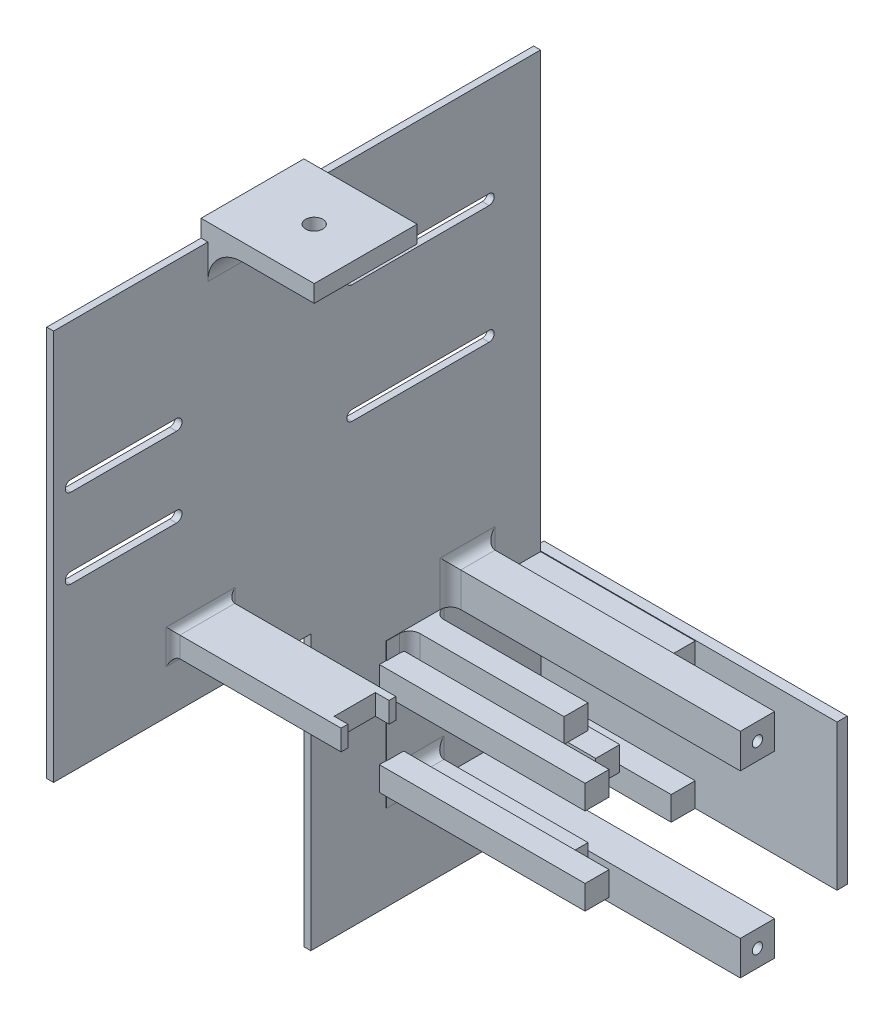
from build123d import *

# Parameters (mm, degrees)
KASSE_W                                = 148
KASSE_H                                = 148
KASSE_MAINBODY_DEPTH                   = 200
SHELL2_START                           = -145
SHELL2_OUTLINE_W                       = 145
SHELL2_OUTLINE_H                       = 194
SHELL2_DEPTH                           = 142
HULLER_TIL_MONTERING_AF_TANDHJUL_DEPTH = 20
SKETCH6_W                              = 45
SKETCH6_H                              = 42.3
MOTORBED_DEPTH                         = 0.1
SKETCH7_W                              = 10
SKETCH7_H                              = 10
MOTORHOLDER_DEPTH                      = 84.5
SKETCH18_W                             = 7
SKETCH18_H                             = 7
BOSS_EXTRUDE6_DEPTH                    = 45
SKETCH9_W                              = 7
SKETCH9_H                              = 7
MOTORHOLDER_2_DEPTH                    = 60
SKETCH8_R                              = 1.5
SKRUER_MOTORHOLDER_DEPTH               = 10
H_BRO_HOLDER_DEPTH                     = 10
SKETCH14_R                             = 10
HUL_DEPTH                              = 10
SKETCH15_W                             = 16
SKETCH15_H                             = 6
BOSS_EXTRUDE4_DEPTH                    = 45
SKETCH17_W                             = 2
SKETCH17_H                             = 6
BOSS_EXTRUDE5_DEPTH                    = 4
FILLET2_R                              = 2
FILLET3_R                              = 3
FILLET4_R                              = 3
SKETCH20_W                             = 148
SKETCH20_H                             = 200
SKETCH20_W_2                           = 142
SKETCH20_H_2                           = 194
FJERNV_G_DEPTH                         = 148
SKETCH24_W                             = 89.449587466
SKETCH24_H                             = 42.5
BOSS_EXTRUDE7_DEPTH                    = 3
SKETCH27_W                             = 34
SKETCH27_H                             = 30
BOSS_EXTRUDE8_DEPTH                    = 5
FILLET5_R                              = 10
SKETCH28_R                             = 2.5
CUT_EXTRUDE1_DEPTH                     = 10
SKETCH29_W                             = 75
SKETCH29_H                             = 80
CUT_EXTRUDE2_DEPTH                     = 10
SKETCH30_W                             = 145
SKETCH30_H                             = 220
CUT_EXTRUDE3_DEPTH                     = 1
SKETCH31_W                             = 53.079596257
SKETCH31_H                             = 27.802057415
CUT_EXTRUDE5_DEPTH                     = 1
SKETCH32_W                             = 15
SKETCH32_H                             = 20
CUT_EXTRUDE6_DEPTH                     = 2


# Read off the part's stored shape, not the designer's step: Shell2
with BuildPart() as part:
    # Kasse → Kasse mainBody (new body)
    with BuildSketch(Plane(origin=(0, 0, 0), x_dir=(1, 0, 0), z_dir=(0, 1, 0))):
        with Locations((-74, 74)):
            Rectangle(KASSE_W, KASSE_H)
    extrude(amount=KASSE_MAINBODY_DEPTH)

    # Shell2 outline → Shell2 (cut)
    with BuildSketch(Plane.XY.offset(SHELL2_START)):
        with Locations((-72.5, 100)):
            Rectangle(SHELL2_OUTLINE_W, SHELL2_OUTLINE_H)
    extrude(amount=SHELL2_DEPTH, mode=Mode.SUBTRACT)

    # Sketch4 → Huller til montering af tandhjul (cut)
    with BuildSketch(Plane(origin=(-145, 0, 0), x_dir=(0, 0, -1), z_dir=(1, 0, 0))):
        with BuildLine():
            Line((8, 133.8), (38.853233891, 133.8))
            ThreePointArc((38.853233891, 133.8), (40.453233891, 132.2), (38.853233891, 130.6))
            Line((38.853233891, 130.6), (8, 130.6))
            ThreePointArc((8, 130.6), (6.4, 132.2), (8, 133.8))
        make_face()
        with BuildLine():
            Line((8, 157), (38.853233891, 157))
            ThreePointArc((38.853233891, 157), (40.453233891, 155.4), (38.853233891, 153.8))
            Line((38.853233891, 153.8), (8, 153.8))
            ThreePointArc((8, 153.8), (6.4, 155.4), (8, 157))
        make_face()
    extrude(amount=-HULLER_TIL_MONTERING_AF_TANDHJUL_DEPTH, mode=Mode.SUBTRACT)

    # Sketch6 → Motorbed (add)
    with BuildSketch(Plane(origin=(-145, 0, 0), x_dir=(0, 0, -1), z_dir=(1, 0, 0))):
        with Locations((122.5, 49.15)):
            Rectangle(SKETCH6_W, SKETCH6_H)
    extrude(amount=MOTORBED_DEPTH)

    # Sketch7 → Motorholder (add)
    with BuildSketch(Plane(origin=(-145, 0, 0), x_dir=(0, 0, -1), z_dir=(1, 0, 0))):
        with Locations((123.75, 75.3)):
            Rectangle(SKETCH7_W, SKETCH7_H)
        with Locations((123.75, 23)):
            Rectangle(SKETCH7_W, SKETCH7_H)
    extrude(amount=MOTORHOLDER_DEPTH)

    # Sketch18 → Boss-Extrude6 (add)
    with BuildSketch(Plane(origin=(-144.9, 0, 0), x_dir=(0, 0, -1), z_dir=(1, 0, 0))):
        with Locations((110.25, 31.5)):
            Rectangle(SKETCH18_W, SKETCH18_H)
        with Locations((141.5, 31.5)):
            Rectangle(SKETCH18_W, SKETCH18_H)
        with Locations((141.5, 66.8)):
            Rectangle(SKETCH18_W, SKETCH18_H)
        with Locations((110.25, 66.8)):
            Rectangle(SKETCH18_W, SKETCH18_H)
        with Locations((121.5, 49.632946646)):
            Rectangle(SKETCH18_W, SKETCH18_H)
    extrude(amount=BOSS_EXTRUDE6_DEPTH)

    # Sketch9 → motorholder  2 (add)
    with BuildSketch(Plane(origin=(-145, 0, 0), x_dir=(0, 0, -1), z_dir=(1, 0, 0))):
        with Locations((101.5, 61.8)):
            Rectangle(SKETCH9_W, SKETCH9_H)
        with Locations((101.5, 36.5)):
            Rectangle(SKETCH9_W, SKETCH9_H)
    extrude(amount=MOTORHOLDER_2_DEPTH)

    # Sketch8 → Skruer motorholder (cut)
    with BuildSketch(Plane(origin=(-60.5, 0, 0), x_dir=(0, 0, -1), z_dir=(1, 0, 0))):
        with Locations((123.75, 75.3)):
            Circle(SKETCH8_R)
        with Locations((123.75, 23)):
            Circle(SKETCH8_R)
    extrude(amount=-SKRUER_MOTORHOLDER_DEPTH, mode=Mode.SUBTRACT)

    # Sketch11 → H-bro holder (cut)
    with BuildSketch(Plane(origin=(-145, 0, 0), x_dir=(0, 0, -1), z_dir=(1, 0, 0))):
        with BuildLine():
            Line((130, 165.21), (90, 165.21))
            ThreePointArc((90, 165.21), (88.5, 166.71), (90, 168.21))
            Line((90, 168.21), (130, 168.21))
            ThreePointArc((130, 168.21), (131.5, 166.71), (130, 165.21))
        make_face()
        with BuildLine():
            Line((130, 130.7), (90, 130.7))
            ThreePointArc((90, 130.7), (88.5, 132.2), (90, 133.7))
            Line((90, 133.7), (130, 133.7))
            ThreePointArc((130, 133.7), (131.5, 132.2), (130, 130.7))
        make_face()
    extrude(amount=-H_BRO_HOLDER_DEPTH, mode=Mode.SUBTRACT)

    # Sketch14 → Hul (cut)
    with BuildSketch(Plane(origin=(0, 200, 0), x_dir=(1, 0, 0), z_dir=(0, 1, 0))):
        with Locations(Location((-82.5, 66.16, 0), (0, 0, 270))):
            Circle(SKETCH14_R)
    extrude(amount=-HUL_DEPTH, mode=Mode.SUBTRACT)

    # Sketch15 → Boss-Extrude4 (add)
    with BuildSketch(Plane(origin=(-145, 0, 0), x_dir=(0, 0, -1), z_dir=(1, 0, 0))):
        with Locations((45.83, 100.81)):
            Rectangle(SKETCH15_W, SKETCH15_H)
    extrude(amount=BOSS_EXTRUDE4_DEPTH)

    # Sketch17 → Boss-Extrude5 (add)
    with BuildSketch(Plane(origin=(-100, 0, 0), x_dir=(0, 0, -1), z_dir=(1, 0, 0))):
        with Locations((52.83, 100.81)):
            Rectangle(SKETCH17_W, SKETCH17_H)
        with Locations((38.83, 100.81)):
            Rectangle(SKETCH17_W, SKETCH17_H)
    extrude(amount=BOSS_EXTRUDE5_DEPTH)

    # Fillet2
    fillet2_edges = [part.edges().sort_by_distance(p)[0] for p in [
        (-145, 100.81, -53.83),
        (-145, 103.81, -45.83),
        (-145, 100.81, -37.83),
        (-145, 97.81, -45.83),
    ]]
    fillet(fillet2_edges, radius=FILLET2_R)

    # Fillet3
    # the kernel refuses this fillet: 3 mm, written as the material it adds along each edge
    with BuildSketch(Plane(origin=(-145, 28, -118.75), x_dir=(0, 0, 1), z_dir=(0, -1, 0)), Plane(origin=(-145, 18, -118.75), x_dir=(0, -1, 0), z_dir=(0, 0, -1)), Plane(origin=(-145, 18, -128.75), x_dir=(0, 0, -1), z_dir=(0, 1, 0))) as fillet3_piece_1:
        with BuildLine():
            CenterArc((FILLET3_R, -FILLET3_R), FILLET3_R, 90, 90)
            Line((0, -FILLET3_R), (0, 0))
            Line((0, 0), (FILLET3_R, 0))
        make_face()
    extrude(amount=10)
    with BuildSketch(Plane(origin=(-145, 80.3, -128.75), x_dir=(0, 0, -1), z_dir=(0, -1, 0)), Plane(origin=(-145, 80.3, -118.75), x_dir=(0, 1, 0), z_dir=(0, 0, -1)), Plane(origin=(-145, 70.3, -118.75), x_dir=(0, 0, 1), z_dir=(0, 1, 0))) as fillet3_piece_2:
        with BuildLine():
            CenterArc((FILLET3_R, FILLET3_R), FILLET3_R, 180, 90)
            Line((0, FILLET3_R), (0, 0))
            Line((0, 0), (FILLET3_R, 0))
        make_face()
    extrude(amount=10)
    with BuildSketch(Plane(origin=(-145, 18, -111.25), x_dir=(0, -1, 0), z_dir=(0, 0, -1))) as fillet3_piece_3a_section:
        with BuildLine():
            CenterArc((FILLET3_R, -FILLET3_R), FILLET3_R, 90, 90)
            Line((0, -FILLET3_R), (0, 0))
            Line((0, 0), (FILLET3_R, 0))
        make_face()
    fillet3_piece_3a = extrude(amount=17.5, mode=Mode.PRIVATE)
    fillet3_piece_3a = split(fillet3_piece_3a, bisect_by=Plane(origin=(-144.320814657, 17.320814657, -118.75), z_dir=(0, 0, 1)), keep=Keep.TOP, mode=Mode.PRIVATE)
    with BuildSketch(Plane(origin=(-145, 28, -118.75), x_dir=(0, 0, 1), z_dir=(0, -1, 0))) as fillet3_piece_3b_section:
        with BuildLine():
            CenterArc((FILLET3_R, -FILLET3_R), FILLET3_R, 90, 90)
            Line((0, -FILLET3_R), (0, 0))
            Line((0, 0), (FILLET3_R, 0))
        make_face()
    fillet3_piece_3b = extrude(amount=17.5, mode=Mode.PRIVATE)
    fillet3_piece_3b = split(fillet3_piece_3b, bisect_by=Plane(origin=(-144.320814657, 18, -118.070814657), z_dir=(0, -1, 0)), keep=Keep.TOP, mode=Mode.PRIVATE)
    fillet3_piece_3 = fillet3_piece_3a & fillet3_piece_3b
    add(fillet3_piece_3)
    with BuildSketch(Plane(origin=(-145, 10.5, -128.75), x_dir=(0, 0, -1), z_dir=(0, 1, 0))) as fillet3_piece_4a_section:
        with BuildLine():
            CenterArc((FILLET3_R, -FILLET3_R), FILLET3_R, 90, 90)
            Line((0, -FILLET3_R), (0, 0))
            Line((0, 0), (FILLET3_R, 0))
        make_face()
    fillet3_piece_4a = extrude(amount=17.5, mode=Mode.PRIVATE)
    fillet3_piece_4a = split(fillet3_piece_4a, bisect_by=Plane(origin=(-144.320814657, 18, -129.429185343), z_dir=(0, -1, 0)), keep=Keep.TOP, mode=Mode.PRIVATE)
    with BuildSketch(Plane(origin=(-145, 18, -118.75), x_dir=(0, -1, 0), z_dir=(0, 0, -1))) as fillet3_piece_4b_section:
        with BuildLine():
            CenterArc((FILLET3_R, -FILLET3_R), FILLET3_R, 90, 90)
            Line((0, -FILLET3_R), (0, 0))
            Line((0, 0), (FILLET3_R, 0))
        make_face()
    fillet3_piece_4b = extrude(amount=17.5, mode=Mode.PRIVATE)
    fillet3_piece_4b = split(fillet3_piece_4b, bisect_by=Plane(origin=(-144.320814657, 17.320814657, -128.75), z_dir=(0, 0, -1)), keep=Keep.TOP, mode=Mode.PRIVATE)
    fillet3_piece_4 = fillet3_piece_4a & fillet3_piece_4b
    add(fillet3_piece_4)
    with BuildSketch(Plane(origin=(-145, 87.8, -128.75), x_dir=(0, 0, -1), z_dir=(0, -1, 0))) as fillet3_piece_5a_section:
        with BuildLine():
            CenterArc((FILLET3_R, FILLET3_R), FILLET3_R, 180, 90)
            Line((0, FILLET3_R), (0, 0))
            Line((0, 0), (FILLET3_R, 0))
        make_face()
    fillet3_piece_5a = extrude(amount=17.5, mode=Mode.PRIVATE)
    fillet3_piece_5a = split(fillet3_piece_5a, bisect_by=Plane(origin=(-144.320814657, 80.3, -129.429185343), z_dir=(0, 1, 0)), keep=Keep.TOP, mode=Mode.PRIVATE)
    with BuildSketch(Plane(origin=(-145, 80.3, -118.75), x_dir=(0, 1, 0), z_dir=(0, 0, -1))) as fillet3_piece_5b_section:
        with BuildLine():
            CenterArc((FILLET3_R, FILLET3_R), FILLET3_R, 180, 90)
            Line((0, FILLET3_R), (0, 0))
            Line((0, 0), (FILLET3_R, 0))
        make_face()
    fillet3_piece_5b = extrude(amount=17.5, mode=Mode.PRIVATE)
    fillet3_piece_5b = split(fillet3_piece_5b, bisect_by=Plane(origin=(-144.320814657, 80.979185343, -128.75), z_dir=(0, 0, -1)), keep=Keep.TOP, mode=Mode.PRIVATE)
    fillet3_piece_5 = fillet3_piece_5a & fillet3_piece_5b
    add(fillet3_piece_5)
    with BuildSketch(Plane(origin=(-145, 80.3, -111.25), x_dir=(0, 1, 0), z_dir=(0, 0, -1))) as fillet3_piece_6a_section:
        with BuildLine():
            CenterArc((FILLET3_R, FILLET3_R), FILLET3_R, 180, 90)
            Line((0, FILLET3_R), (0, 0))
            Line((0, 0), (FILLET3_R, 0))
        make_face()
    fillet3_piece_6a = extrude(amount=17.5, mode=Mode.PRIVATE)
    fillet3_piece_6a = split(fillet3_piece_6a, bisect_by=Plane(origin=(-144.320814657, 80.979185343, -118.75), z_dir=(0, 0, 1)), keep=Keep.TOP, mode=Mode.PRIVATE)
    with BuildSketch(Plane(origin=(-145, 70.3, -118.75), x_dir=(0, 0, 1), z_dir=(0, 1, 0))) as fillet3_piece_6b_section:
        with BuildLine():
            CenterArc((FILLET3_R, FILLET3_R), FILLET3_R, 180, 90)
            Line((0, FILLET3_R), (0, 0))
            Line((0, 0), (FILLET3_R, 0))
        make_face()
    fillet3_piece_6b = extrude(amount=17.5, mode=Mode.PRIVATE)
    fillet3_piece_6b = split(fillet3_piece_6b, bisect_by=Plane(origin=(-144.320814657, 80.3, -118.070814657), z_dir=(0, 1, 0)), keep=Keep.TOP, mode=Mode.PRIVATE)
    fillet3_piece_6 = fillet3_piece_6a & fillet3_piece_6b
    add(fillet3_piece_6)

    # Fillet4
    # the kernel refuses this fillet: 3 mm, written as the material it adds along each edge
    with BuildSketch(Plane(origin=(-144.9, 28, -113.75), x_dir=(0, 0, -1), z_dir=(0, 1, 0)), Plane(origin=(-144.9, 35, -113.75), x_dir=(0, 1, 0), z_dir=(0, 0, 1)), Plane(origin=(-144.9, 35, -106.75), x_dir=(0, 0, 1), z_dir=(0, -1, 0)), Plane(origin=(-144.9, 35, -145), x_dir=(0, 1, 0), z_dir=(0, 0, 1)), Plane(origin=(-144.9, 35, -138), x_dir=(0, 0, 1), z_dir=(0, -1, 0)), Plane(origin=(-144.9, 63.3, -113.75), x_dir=(0, 0, -1), z_dir=(0, 1, 0)), Plane(origin=(-144.9, 70.3, -106.75), x_dir=(0, 0, 1), z_dir=(0, -1, 0)), Plane(origin=(-144.9, 63.3, -106.75), x_dir=(0, -1, 0), z_dir=(0, 0, -1))) as fillet4_piece_1:
        with BuildLine():
            CenterArc((FILLET4_R, -FILLET4_R), FILLET4_R, 90, 90)
            Line((0, -FILLET4_R), (-FILLET4_R * 0.02, -FILLET4_R))
            Line((-FILLET4_R * 0.02, -FILLET4_R), (-FILLET4_R * 0.02, FILLET4_R * 0.02))
            Line((-FILLET4_R * 0.02, FILLET4_R * 0.02), (FILLET4_R, FILLET4_R * 0.02))
            Line((FILLET4_R, FILLET4_R * 0.02), (FILLET4_R, 0))
        make_face()
    extrude(amount=7)
    with BuildSketch(Plane(origin=(-144.9, 70.3, -138), x_dir=(1, 0, 0), z_dir=(0, -1, 0)), Plane(origin=(-144.9, 63.3, -138), x_dir=(1, 0, 0), z_dir=(0, 0, -1)), Plane(origin=(-144.9, 53.132946646, -118), x_dir=(0, 1, 0), z_dir=(0, 0, -1)), Plane(origin=(-144.9, 46.132946646, -118), x_dir=(0, 0, 1), z_dir=(0, 1, 0)), Plane(origin=(-144.9, 46.132946646, -125), x_dir=(0, -1, 0), z_dir=(0, 0, 1)), Plane(origin=(-144.9, 53.132946646, -125), x_dir=(0, 0, -1), z_dir=(0, -1, 0))) as fillet4_piece_2:
        with BuildLine():
            CenterArc((FILLET4_R, FILLET4_R), FILLET4_R, 180, 90)
            Line((0, FILLET4_R), (-FILLET4_R * 0.02, FILLET4_R))
            Line((-FILLET4_R * 0.02, FILLET4_R), (-FILLET4_R * 0.02, -FILLET4_R * 0.02))
            Line((-FILLET4_R * 0.02, -FILLET4_R * 0.02), (FILLET4_R, -FILLET4_R * 0.02))
            Line((FILLET4_R, -FILLET4_R * 0.02), (FILLET4_R, 0))
        make_face()
    extrude(amount=7)
    with BuildSketch(Plane(origin=(-144.9, 35, -121.25), x_dir=(0, 1, 0), z_dir=(0, 0, 1))) as fillet4_piece_3a_section:
        with BuildLine():
            CenterArc((FILLET4_R, -FILLET4_R), FILLET4_R, 90, 90)
            Line((0, -FILLET4_R), (-FILLET4_R * 0.02, -FILLET4_R))
            Line((-FILLET4_R * 0.02, -FILLET4_R), (-FILLET4_R * 0.02, FILLET4_R * 0.02))
            Line((-FILLET4_R * 0.02, FILLET4_R * 0.02), (FILLET4_R, FILLET4_R * 0.02))
            Line((FILLET4_R, FILLET4_R * 0.02), (FILLET4_R, 0))
        make_face()
    fillet4_piece_3a = extrude(amount=14.5, mode=Mode.PRIVATE)
    fillet4_piece_3a = split(fillet4_piece_3a, bisect_by=Plane(origin=(-144.220814657, 35.679185343, -113.75), z_dir=(0, 0, -1)), keep=Keep.TOP, mode=Mode.PRIVATE)
    with BuildSketch(Plane(origin=(-144.9, 28, -113.75), x_dir=(0, 0, -1), z_dir=(0, 1, 0))) as fillet4_piece_3b_section:
        with BuildLine():
            CenterArc((FILLET4_R, -FILLET4_R), FILLET4_R, 90, 90)
            Line((0, -FILLET4_R), (-FILLET4_R * 0.02, -FILLET4_R))
            Line((-FILLET4_R * 0.02, -FILLET4_R), (-FILLET4_R * 0.02, FILLET4_R * 0.02))
            Line((-FILLET4_R * 0.02, FILLET4_R * 0.02), (FILLET4_R, FILLET4_R * 0.02))
            Line((FILLET4_R, FILLET4_R * 0.02), (FILLET4_R, 0))
        make_face()
    fillet4_piece_3b = extrude(amount=14.5, mode=Mode.PRIVATE)
    fillet4_piece_3b = split(fillet4_piece_3b, bisect_by=Plane(origin=(-144.220814657, 35, -114.429185343), z_dir=(0, 1, 0)), keep=Keep.TOP, mode=Mode.PRIVATE)
    fillet4_piece_3 = fillet4_piece_3a & fillet4_piece_3b
    add(fillet4_piece_3)
    with BuildSketch(Plane(origin=(-144.9, 42.5, -106.75), x_dir=(0, 0, 1), z_dir=(0, -1, 0))) as fillet4_piece_4a_section:
        with BuildLine():
            CenterArc((FILLET4_R, -FILLET4_R), FILLET4_R, 90, 90)
            Line((0, -FILLET4_R), (-FILLET4_R * 0.02, -FILLET4_R))
            Line((-FILLET4_R * 0.02, -FILLET4_R), (-FILLET4_R * 0.02, FILLET4_R * 0.02))
            Line((-FILLET4_R * 0.02, FILLET4_R * 0.02), (FILLET4_R, FILLET4_R * 0.02))
            Line((FILLET4_R, FILLET4_R * 0.02), (FILLET4_R, 0))
        make_face()
    fillet4_piece_4a = extrude(amount=14.5, mode=Mode.PRIVATE)
    fillet4_piece_4a = split(fillet4_piece_4a, bisect_by=Plane(origin=(-144.220814657, 35, -106.070814657), z_dir=(0, 1, 0)), keep=Keep.TOP, mode=Mode.PRIVATE)
    with BuildSketch(Plane(origin=(-144.9, 35, -113.75), x_dir=(0, 1, 0), z_dir=(0, 0, 1))) as fillet4_piece_4b_section:
        with BuildLine():
            CenterArc((FILLET4_R, -FILLET4_R), FILLET4_R, 90, 90)
            Line((0, -FILLET4_R), (-FILLET4_R * 0.02, -FILLET4_R))
            Line((-FILLET4_R * 0.02, -FILLET4_R), (-FILLET4_R * 0.02, FILLET4_R * 0.02))
            Line((-FILLET4_R * 0.02, FILLET4_R * 0.02), (FILLET4_R, FILLET4_R * 0.02))
            Line((FILLET4_R, FILLET4_R * 0.02), (FILLET4_R, 0))
        make_face()
    fillet4_piece_4b = extrude(amount=14.5, mode=Mode.PRIVATE)
    fillet4_piece_4b = split(fillet4_piece_4b, bisect_by=Plane(origin=(-144.220814657, 35.679185343, -106.75), z_dir=(0, 0, 1)), keep=Keep.TOP, mode=Mode.PRIVATE)
    fillet4_piece_4 = fillet4_piece_4a & fillet4_piece_4b
    add(fillet4_piece_4)
    with BuildSketch(Plane(origin=(-144.9, 42.5, -138), x_dir=(0, 0, 1), z_dir=(0, -1, 0))) as fillet4_piece_5a_section:
        with BuildLine():
            CenterArc((FILLET4_R, -FILLET4_R), FILLET4_R, 90, 90)
            Line((0, -FILLET4_R), (-FILLET4_R * 0.02, -FILLET4_R))
            Line((-FILLET4_R * 0.02, -FILLET4_R), (-FILLET4_R * 0.02, FILLET4_R * 0.02))
            Line((-FILLET4_R * 0.02, FILLET4_R * 0.02), (FILLET4_R, FILLET4_R * 0.02))
            Line((FILLET4_R, FILLET4_R * 0.02), (FILLET4_R, 0))
        make_face()
    fillet4_piece_5a = extrude(amount=14.5, mode=Mode.PRIVATE)
    fillet4_piece_5a = split(fillet4_piece_5a, bisect_by=Plane(origin=(-144.220814657, 35, -137.320814657), z_dir=(0, 1, 0)), keep=Keep.TOP, mode=Mode.PRIVATE)
    with BuildSketch(Plane(origin=(-144.9, 35, -145), x_dir=(0, 1, 0), z_dir=(0, 0, 1))) as fillet4_piece_5b_section:
        with BuildLine():
            CenterArc((FILLET4_R, -FILLET4_R), FILLET4_R, 90, 90)
            Line((0, -FILLET4_R), (-FILLET4_R * 0.02, -FILLET4_R))
            Line((-FILLET4_R * 0.02, -FILLET4_R), (-FILLET4_R * 0.02, FILLET4_R * 0.02))
            Line((-FILLET4_R * 0.02, FILLET4_R * 0.02), (FILLET4_R, FILLET4_R * 0.02))
            Line((FILLET4_R, FILLET4_R * 0.02), (FILLET4_R, 0))
        make_face()
    fillet4_piece_5b = extrude(amount=14.5, mode=Mode.PRIVATE)
    fillet4_piece_5b = split(fillet4_piece_5b, bisect_by=Plane(origin=(-144.220814657, 35.679185343, -138), z_dir=(0, 0, 1)), keep=Keep.TOP, mode=Mode.PRIVATE)
    fillet4_piece_5 = fillet4_piece_5a & fillet4_piece_5b
    add(fillet4_piece_5)
    with BuildSketch(Plane(origin=(-144.9, 63.3, -130.5), x_dir=(1, 0, 0), z_dir=(0, 0, -1))) as fillet4_piece_6a_section:
        with BuildLine():
            CenterArc((FILLET4_R, FILLET4_R), FILLET4_R, 180, 90)
            Line((0, FILLET4_R), (-FILLET4_R * 0.02, FILLET4_R))
            Line((-FILLET4_R * 0.02, FILLET4_R), (-FILLET4_R * 0.02, -FILLET4_R * 0.02))
            Line((-FILLET4_R * 0.02, -FILLET4_R * 0.02), (FILLET4_R, -FILLET4_R * 0.02))
            Line((FILLET4_R, -FILLET4_R * 0.02), (FILLET4_R, 0))
        make_face()
    fillet4_piece_6a = extrude(amount=14.5, mode=Mode.PRIVATE)
    fillet4_piece_6a = split(fillet4_piece_6a, bisect_by=Plane(origin=(-144.220814657, 62.620814657, -138), z_dir=(0, 0, 1)), keep=Keep.TOP, mode=Mode.PRIVATE)
    with BuildSketch(Plane(origin=(-144.9, 70.3, -138), x_dir=(1, 0, 0), z_dir=(0, -1, 0))) as fillet4_piece_6b_section:
        with BuildLine():
            CenterArc((FILLET4_R, FILLET4_R), FILLET4_R, 180, 90)
            Line((0, FILLET4_R), (-FILLET4_R * 0.02, FILLET4_R))
            Line((-FILLET4_R * 0.02, FILLET4_R), (-FILLET4_R * 0.02, -FILLET4_R * 0.02))
            Line((-FILLET4_R * 0.02, -FILLET4_R * 0.02), (FILLET4_R, -FILLET4_R * 0.02))
            Line((FILLET4_R, -FILLET4_R * 0.02), (FILLET4_R, 0))
        make_face()
    fillet4_piece_6b = extrude(amount=14.5, mode=Mode.PRIVATE)
    fillet4_piece_6b = split(fillet4_piece_6b, bisect_by=Plane(origin=(-144.220814657, 63.3, -137.320814657), z_dir=(0, -1, 0)), keep=Keep.TOP, mode=Mode.PRIVATE)
    fillet4_piece_6 = fillet4_piece_6a & fillet4_piece_6b
    add(fillet4_piece_6)
    with BuildSketch(Plane(origin=(-144.9, 55.8, -113.75), x_dir=(0, 0, -1), z_dir=(0, 1, 0))) as fillet4_piece_7a_section:
        with BuildLine():
            CenterArc((FILLET4_R, -FILLET4_R), FILLET4_R, 90, 90)
            Line((0, -FILLET4_R), (-FILLET4_R * 0.02, -FILLET4_R))
            Line((-FILLET4_R * 0.02, -FILLET4_R), (-FILLET4_R * 0.02, FILLET4_R * 0.02))
            Line((-FILLET4_R * 0.02, FILLET4_R * 0.02), (FILLET4_R, FILLET4_R * 0.02))
            Line((FILLET4_R, FILLET4_R * 0.02), (FILLET4_R, 0))
        make_face()
    fillet4_piece_7a = extrude(amount=14.5, mode=Mode.PRIVATE)
    fillet4_piece_7a = split(fillet4_piece_7a, bisect_by=Plane(origin=(-144.220814657, 63.3, -114.429185343), z_dir=(0, -1, 0)), keep=Keep.TOP, mode=Mode.PRIVATE)
    with BuildSketch(Plane(origin=(-144.9, 63.3, -106.75), x_dir=(0, -1, 0), z_dir=(0, 0, -1))) as fillet4_piece_7b_section:
        with BuildLine():
            CenterArc((FILLET4_R, -FILLET4_R), FILLET4_R, 90, 90)
            Line((0, -FILLET4_R), (-FILLET4_R * 0.02, -FILLET4_R))
            Line((-FILLET4_R * 0.02, -FILLET4_R), (-FILLET4_R * 0.02, FILLET4_R * 0.02))
            Line((-FILLET4_R * 0.02, FILLET4_R * 0.02), (FILLET4_R, FILLET4_R * 0.02))
            Line((FILLET4_R, FILLET4_R * 0.02), (FILLET4_R, 0))
        make_face()
    fillet4_piece_7b = extrude(amount=14.5, mode=Mode.PRIVATE)
    fillet4_piece_7b = split(fillet4_piece_7b, bisect_by=Plane(origin=(-144.220814657, 62.620814657, -113.75), z_dir=(0, 0, -1)), keep=Keep.TOP, mode=Mode.PRIVATE)
    fillet4_piece_7 = fillet4_piece_7a & fillet4_piece_7b
    add(fillet4_piece_7)
    with BuildSketch(Plane(origin=(-144.9, 63.3, -99.25), x_dir=(0, -1, 0), z_dir=(0, 0, -1))) as fillet4_piece_8a_section:
        with BuildLine():
            CenterArc((FILLET4_R, -FILLET4_R), FILLET4_R, 90, 90)
            Line((0, -FILLET4_R), (-FILLET4_R * 0.02, -FILLET4_R))
            Line((-FILLET4_R * 0.02, -FILLET4_R), (-FILLET4_R * 0.02, FILLET4_R * 0.02))
            Line((-FILLET4_R * 0.02, FILLET4_R * 0.02), (FILLET4_R, FILLET4_R * 0.02))
            Line((FILLET4_R, FILLET4_R * 0.02), (FILLET4_R, 0))
        make_face()
    fillet4_piece_8a = extrude(amount=14.5, mode=Mode.PRIVATE)
    fillet4_piece_8a = split(fillet4_piece_8a, bisect_by=Plane(origin=(-144.220814657, 62.620814657, -106.75), z_dir=(0, 0, 1)), keep=Keep.TOP, mode=Mode.PRIVATE)
    with BuildSketch(Plane(origin=(-144.9, 70.3, -106.75), x_dir=(0, 0, 1), z_dir=(0, -1, 0))) as fillet4_piece_8b_section:
        with BuildLine():
            CenterArc((FILLET4_R, -FILLET4_R), FILLET4_R, 90, 90)
            Line((0, -FILLET4_R), (-FILLET4_R * 0.02, -FILLET4_R))
            Line((-FILLET4_R * 0.02, -FILLET4_R), (-FILLET4_R * 0.02, FILLET4_R * 0.02))
            Line((-FILLET4_R * 0.02, FILLET4_R * 0.02), (FILLET4_R, FILLET4_R * 0.02))
            Line((FILLET4_R, FILLET4_R * 0.02), (FILLET4_R, 0))
        make_face()
    fillet4_piece_8b = extrude(amount=14.5, mode=Mode.PRIVATE)
    fillet4_piece_8b = split(fillet4_piece_8b, bisect_by=Plane(origin=(-144.220814657, 63.3, -106.070814657), z_dir=(0, -1, 0)), keep=Keep.TOP, mode=Mode.PRIVATE)
    fillet4_piece_8 = fillet4_piece_8a & fillet4_piece_8b
    add(fillet4_piece_8)
    with BuildSketch(Plane(origin=(-144.9, 53.132946646, -110.5), x_dir=(0, 1, 0), z_dir=(0, 0, -1))) as fillet4_piece_9a_section:
        with BuildLine():
            CenterArc((FILLET4_R, FILLET4_R), FILLET4_R, 180, 90)
            Line((0, FILLET4_R), (-FILLET4_R * 0.02, FILLET4_R))
            Line((-FILLET4_R * 0.02, FILLET4_R), (-FILLET4_R * 0.02, -FILLET4_R * 0.02))
            Line((-FILLET4_R * 0.02, -FILLET4_R * 0.02), (FILLET4_R, -FILLET4_R * 0.02))
            Line((FILLET4_R, -FILLET4_R * 0.02), (FILLET4_R, 0))
        make_face()
    fillet4_piece_9a = extrude(amount=14.5, mode=Mode.PRIVATE)
    fillet4_piece_9a = split(fillet4_piece_9a, bisect_by=Plane(origin=(-144.220814657, 53.812131989, -118), z_dir=(0, 0, 1)), keep=Keep.TOP, mode=Mode.PRIVATE)
    with BuildSketch(Plane(origin=(-144.9, 46.132946646, -118), x_dir=(0, 0, 1), z_dir=(0, 1, 0))) as fillet4_piece_9b_section:
        with BuildLine():
            CenterArc((FILLET4_R, FILLET4_R), FILLET4_R, 180, 90)
            Line((0, FILLET4_R), (-FILLET4_R * 0.02, FILLET4_R))
            Line((-FILLET4_R * 0.02, FILLET4_R), (-FILLET4_R * 0.02, -FILLET4_R * 0.02))
            Line((-FILLET4_R * 0.02, -FILLET4_R * 0.02), (FILLET4_R, -FILLET4_R * 0.02))
            Line((FILLET4_R, -FILLET4_R * 0.02), (FILLET4_R, 0))
        make_face()
    fillet4_piece_9b = extrude(amount=14.5, mode=Mode.PRIVATE)
    fillet4_piece_9b = split(fillet4_piece_9b, bisect_by=Plane(origin=(-144.220814657, 53.132946646, -117.320814657), z_dir=(0, 1, 0)), keep=Keep.TOP, mode=Mode.PRIVATE)
    fillet4_piece_9 = fillet4_piece_9a & fillet4_piece_9b
    add(fillet4_piece_9)
    with BuildSketch(Plane(origin=(-144.9, 53.132946646, -118), x_dir=(0, 1, 0), z_dir=(0, 0, -1))) as fillet4_piece_10a_section:
        with BuildLine():
            CenterArc((FILLET4_R, FILLET4_R), FILLET4_R, 180, 90)
            Line((0, FILLET4_R), (-FILLET4_R * 0.02, FILLET4_R))
            Line((-FILLET4_R * 0.02, FILLET4_R), (-FILLET4_R * 0.02, -FILLET4_R * 0.02))
            Line((-FILLET4_R * 0.02, -FILLET4_R * 0.02), (FILLET4_R, -FILLET4_R * 0.02))
            Line((FILLET4_R, -FILLET4_R * 0.02), (FILLET4_R, 0))
        make_face()
    fillet4_piece_10a = extrude(amount=14.5, mode=Mode.PRIVATE)
    fillet4_piece_10a = split(fillet4_piece_10a, bisect_by=Plane(origin=(-144.220814657, 53.812131989, -125), z_dir=(0, 0, -1)), keep=Keep.TOP, mode=Mode.PRIVATE)
    with BuildSketch(Plane(origin=(-144.9, 60.632946646, -125), x_dir=(0, 0, -1), z_dir=(0, -1, 0))) as fillet4_piece_10b_section:
        with BuildLine():
            CenterArc((FILLET4_R, FILLET4_R), FILLET4_R, 180, 90)
            Line((0, FILLET4_R), (-FILLET4_R * 0.02, FILLET4_R))
            Line((-FILLET4_R * 0.02, FILLET4_R), (-FILLET4_R * 0.02, -FILLET4_R * 0.02))
            Line((-FILLET4_R * 0.02, -FILLET4_R * 0.02), (FILLET4_R, -FILLET4_R * 0.02))
            Line((FILLET4_R, -FILLET4_R * 0.02), (FILLET4_R, 0))
        make_face()
    fillet4_piece_10b = extrude(amount=14.5, mode=Mode.PRIVATE)
    fillet4_piece_10b = split(fillet4_piece_10b, bisect_by=Plane(origin=(-144.220814657, 53.132946646, -125.679185343), z_dir=(0, 1, 0)), keep=Keep.TOP, mode=Mode.PRIVATE)
    fillet4_piece_10 = fillet4_piece_10a & fillet4_piece_10b
    add(fillet4_piece_10)
    with BuildSketch(Plane(origin=(-144.9, 46.132946646, -125), x_dir=(0, -1, 0), z_dir=(0, 0, 1))) as fillet4_piece_11a_section:
        with BuildLine():
            CenterArc((FILLET4_R, FILLET4_R), FILLET4_R, 180, 90)
            Line((0, FILLET4_R), (-FILLET4_R * 0.02, FILLET4_R))
            Line((-FILLET4_R * 0.02, FILLET4_R), (-FILLET4_R * 0.02, -FILLET4_R * 0.02))
            Line((-FILLET4_R * 0.02, -FILLET4_R * 0.02), (FILLET4_R, -FILLET4_R * 0.02))
            Line((FILLET4_R, -FILLET4_R * 0.02), (FILLET4_R, 0))
        make_face()
    fillet4_piece_11a = extrude(amount=14.5, mode=Mode.PRIVATE)
    fillet4_piece_11a = split(fillet4_piece_11a, bisect_by=Plane(origin=(-144.220814657, 45.453761303, -118), z_dir=(0, 0, 1)), keep=Keep.TOP, mode=Mode.PRIVATE)
    with BuildSketch(Plane(origin=(-144.9, 38.632946646, -118), x_dir=(0, 0, 1), z_dir=(0, 1, 0))) as fillet4_piece_11b_section:
        with BuildLine():
            CenterArc((FILLET4_R, FILLET4_R), FILLET4_R, 180, 90)
            Line((0, FILLET4_R), (-FILLET4_R * 0.02, FILLET4_R))
            Line((-FILLET4_R * 0.02, FILLET4_R), (-FILLET4_R * 0.02, -FILLET4_R * 0.02))
            Line((-FILLET4_R * 0.02, -FILLET4_R * 0.02), (FILLET4_R, -FILLET4_R * 0.02))
            Line((FILLET4_R, -FILLET4_R * 0.02), (FILLET4_R, 0))
        make_face()
    fillet4_piece_11b = extrude(amount=14.5, mode=Mode.PRIVATE)
    fillet4_piece_11b = split(fillet4_piece_11b, bisect_by=Plane(origin=(-144.220814657, 46.132946646, -117.320814657), z_dir=(0, -1, 0)), keep=Keep.TOP, mode=Mode.PRIVATE)
    fillet4_piece_11 = fillet4_piece_11a & fillet4_piece_11b
    add(fillet4_piece_11)
    with BuildSketch(Plane(origin=(-144.9, 53.132946646, -125), x_dir=(0, 0, -1), z_dir=(0, -1, 0))) as fillet4_piece_12a_section:
        with BuildLine():
            CenterArc((FILLET4_R, FILLET4_R), FILLET4_R, 180, 90)
            Line((0, FILLET4_R), (-FILLET4_R * 0.02, FILLET4_R))
            Line((-FILLET4_R * 0.02, FILLET4_R), (-FILLET4_R * 0.02, -FILLET4_R * 0.02))
            Line((-FILLET4_R * 0.02, -FILLET4_R * 0.02), (FILLET4_R, -FILLET4_R * 0.02))
            Line((FILLET4_R, -FILLET4_R * 0.02), (FILLET4_R, 0))
        make_face()
    fillet4_piece_12a = extrude(amount=14.5, mode=Mode.PRIVATE)
    fillet4_piece_12a = split(fillet4_piece_12a, bisect_by=Plane(origin=(-144.220814657, 46.132946646, -125.679185343), z_dir=(0, -1, 0)), keep=Keep.TOP, mode=Mode.PRIVATE)
    with BuildSketch(Plane(origin=(-144.9, 46.132946646, -132.5), x_dir=(0, -1, 0), z_dir=(0, 0, 1))) as fillet4_piece_12b_section:
        with BuildLine():
            CenterArc((FILLET4_R, FILLET4_R), FILLET4_R, 180, 90)
            Line((0, FILLET4_R), (-FILLET4_R * 0.02, FILLET4_R))
            Line((-FILLET4_R * 0.02, FILLET4_R), (-FILLET4_R * 0.02, -FILLET4_R * 0.02))
            Line((-FILLET4_R * 0.02, -FILLET4_R * 0.02), (FILLET4_R, -FILLET4_R * 0.02))
            Line((FILLET4_R, -FILLET4_R * 0.02), (FILLET4_R, 0))
        make_face()
    fillet4_piece_12b = extrude(amount=14.5, mode=Mode.PRIVATE)
    fillet4_piece_12b = split(fillet4_piece_12b, bisect_by=Plane(origin=(-144.220814657, 45.453761303, -125), z_dir=(0, 0, -1)), keep=Keep.TOP, mode=Mode.PRIVATE)
    fillet4_piece_12 = fillet4_piece_12a & fillet4_piece_12b
    add(fillet4_piece_12)

    # Sketch20 → FJERNVÆG (cut)
    with BuildSketch(Plane(origin=(0, 0, 0), x_dir=(0, 0, -1), z_dir=(1, 0, 0))):
        with Locations((74, 100)):
            Rectangle(SKETCH20_W, SKETCH20_H)
        with Locations((74, 100)):
            Rectangle(SKETCH20_W_2, SKETCH20_H_2, mode=Mode.SUBTRACT)
    extrude(amount=-FJERNV_G_DEPTH, mode=Mode.SUBTRACT)

    # Sketch24 → Boss-Extrude7 (add)
    with BuildSketch(Plane(origin=(0, 0, -145), x_dir=(-1, 0, 0), z_dir=(0, 0, -1))):
        with Locations((103.275206267, 49.25)):
            Rectangle(SKETCH24_W, SKETCH24_H)
    extrude(amount=BOSS_EXTRUDE7_DEPTH)

    # Sketch27 → Boss-Extrude8 (add)
    with BuildSketch(Plane(origin=(0, 197, 0), x_dir=(1, 0, 0), z_dir=(0, 1, 0))):
        with Locations((-131, 63)):
            Rectangle(SKETCH27_W, SKETCH27_H)
    extrude(amount=BOSS_EXTRUDE8_DEPTH)

    # Fillet5
    fillet5_edges = [part.edges().sort_by_distance(p)[0] for p in [
        (-145, 197, -63),
    ]]
    fillet(fillet5_edges, radius=FILLET5_R)

    # Sketch28 → Cut-Extrude1 (cut)
    with BuildSketch(Plane(origin=(0, 197, 0), x_dir=(-1, 0, 0), z_dir=(0, -1, 0))):
        with Locations(Location((129, 63, 0), (0, 0, 90))):
            Circle(SKETCH28_R)
    extrude(amount=-CUT_EXTRUDE1_DEPTH, mode=Mode.SUBTRACT)

    # Sketch29 → Cut-Extrude2 (cut)
    with BuildSketch(Plane(origin=(-145, 0, 0), x_dir=(0, 0, -1), z_dir=(1, 0, 0))):
        with Locations((40.5, 43)):
            Rectangle(SKETCH29_W, SKETCH29_H)
    extrude(amount=-CUT_EXTRUDE2_DEPTH, mode=Mode.SUBTRACT)

    # Sketch30 → Cut-Extrude3 (cut)
    with BuildSketch(Plane.ZY.offset(148)):
        with Locations((-75.5, 87)):
            Rectangle(SKETCH30_W, SKETCH30_H)
    extrude(amount=-CUT_EXTRUDE3_DEPTH, mode=Mode.SUBTRACT)

    # Sketch31 → Cut-Extrude5 (cut)
    with BuildSketch(Plane.ZY.offset(147)):
        with Locations((-58.198762769, 206.163730698)):
            Rectangle(SKETCH31_W, SKETCH31_H)
    extrude(amount=CUT_EXTRUDE5_DEPTH, mode=Mode.SUBTRACT)

    # Sketch32 → Cut-Extrude6 (cut)
    with BuildSketch(Plane(origin=(-99.9, 0, 0), x_dir=(0, 0, -1), z_dir=(1, 0, 0))):
        with Locations((117.5, 51.022633584)):
            Rectangle(SKETCH32_W, SKETCH32_H)
    extrude(amount=-CUT_EXTRUDE6_DEPTH, mode=Mode.SUBTRACT)


solid = part.part
